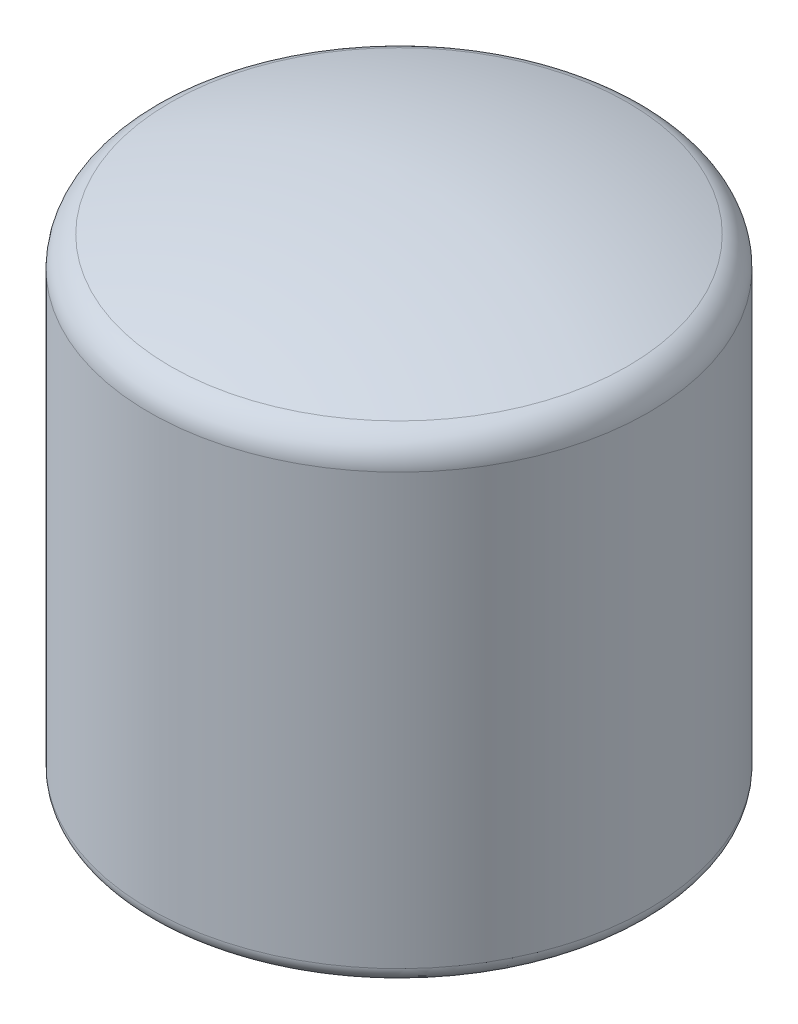
from build123d import *

# Parameters (mm, degrees)
CONG_1_R = 2
CONG_2_R = 1


with BuildPart() as part:
    # Esquisse1 → Révolution1 (revolve)
    with BuildSketch(Plane.XY):
        with BuildLine():
            Line((0, 31.9), (0, 28.9))
            Line((0, 28.9), (-12.5, 28.9))
            Line((-12.5, 28.9), (-12.5, 12.6))
            Line((-12.5, 12.6), (-12.5, 9.3))
            Line((-12.5, 9.3), (-9, 9.3))
            Line((-9, 9.3), (-9, 6.3))
            Line((-9, 6.3), (-12.5, 6.3))
            Line((-12.5, 6.3), (-12.5, 3))
            Line((-12.5, 3), (-9, 3))
            Line((-9, 3), (-9, 0))
            Line((-9, 0), (-12.5, 0))
            Line((-12.5, 0), (-16, 0))
            Line((-16, 0), (-16, 29.95948169))
            ThreePointArc((-16, 29.95948169), (-8.133981927, 32.158765663), (0, 32.9))
            Line((0, 32.9), (0, 31.9))
        make_face()
    revolve(axis=Axis((0, 0, 0), (0, 1, 0)))

    # Congé1
    cong_1_edges = [part.edges().sort_by_distance(p)[0] for p in [
        (16, 29.95948169, 0),
    ]]
    fillet(cong_1_edges, radius=CONG_1_R)

    # Congé2
    cong_2_edges = [part.edges().sort_by_distance(p)[0] for p in [
        (16, 0, 0),
    ]]
    fillet(cong_2_edges, radius=CONG_2_R)


solid = part.part
